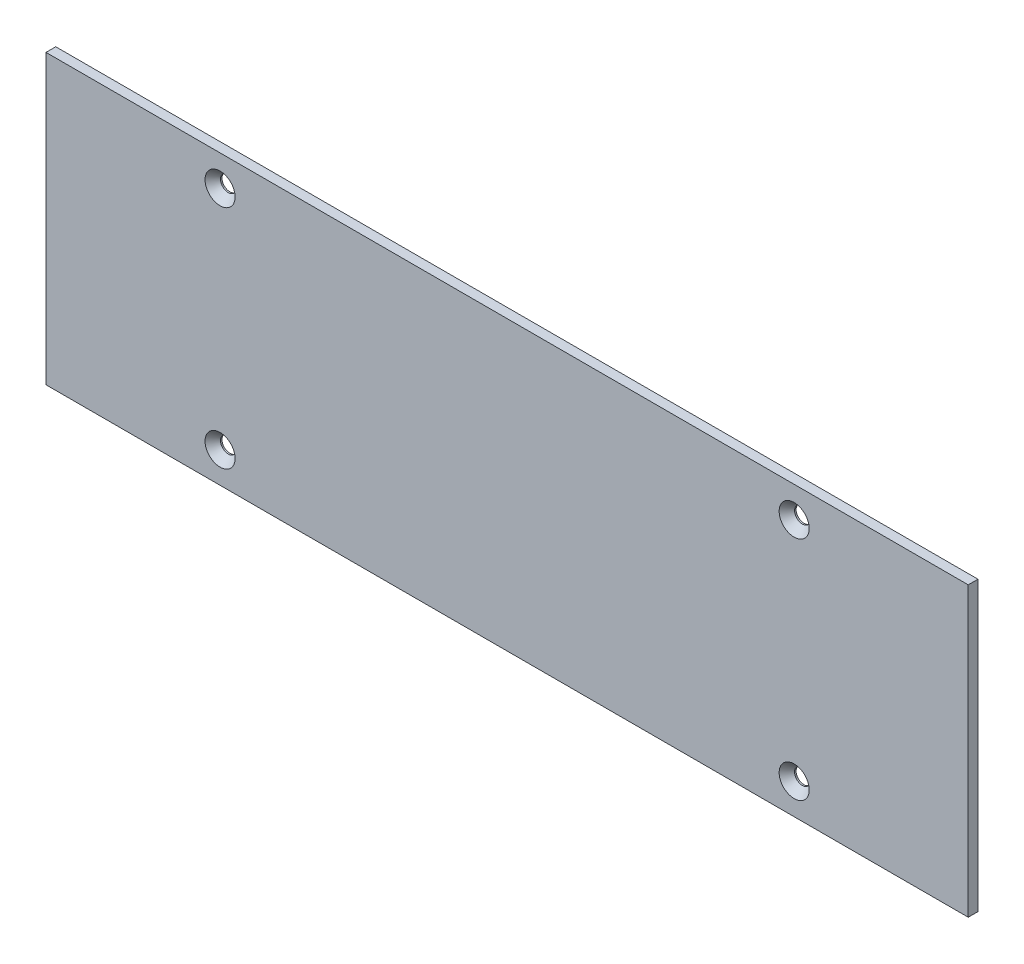
from build123d import *

# Parameters (mm, degrees)
SKETCH1_W                                       = 299.999999694
SKETCH1_H                                       = 93.649999898
BOSS_EXTRUDE1_DEPTH                             = 3.175
CSK_FOR_10_FLAT_HEAD_MACHINE_SCREW1_D           = 5.1054
CSK_FOR_10_FLAT_HEAD_MACHINE_SCREW1_DEPTH       = 4.826
CSK_FOR_10_FLAT_HEAD_MACHINE_SCREW1_CSINK_D     = 9.779
CSK_FOR_10_FLAT_HEAD_MACHINE_SCREW1_CSINK_ANGLE = 82
CSK_FOR_10_FLAT_HEAD_MACHINE_SCREW1_TIP         = 1.533816902


with BuildPart() as part:
    # Sketch1 → Boss-Extrude1 (new body)
    with BuildSketch(Plane.XY):
        Rectangle(SKETCH1_W, SKETCH1_H)
    extrude(amount=BOSS_EXTRUDE1_DEPTH)

    # CSK for #10 Flat Head Machine Screw1
    with Locations(Plane.XY.offset(3.175)):
        with Locations((-93.374999847, 36.824999949), (93.374999847, 36.824999949), (93.374999847, -36.824999949), (-93.374999847, -36.824999949)):
            CounterSinkHole(CSK_FOR_10_FLAT_HEAD_MACHINE_SCREW1_D / 2, CSK_FOR_10_FLAT_HEAD_MACHINE_SCREW1_CSINK_D / 2, depth=CSK_FOR_10_FLAT_HEAD_MACHINE_SCREW1_DEPTH, counter_sink_angle=CSK_FOR_10_FLAT_HEAD_MACHINE_SCREW1_CSINK_ANGLE)
            with Locations((0, 0, -(CSK_FOR_10_FLAT_HEAD_MACHINE_SCREW1_DEPTH + CSK_FOR_10_FLAT_HEAD_MACHINE_SCREW1_TIP / 2))):  # 118° drill point
                Cone(0, CSK_FOR_10_FLAT_HEAD_MACHINE_SCREW1_D / 2, CSK_FOR_10_FLAT_HEAD_MACHINE_SCREW1_TIP, mode=Mode.SUBTRACT)


solid = part.part
